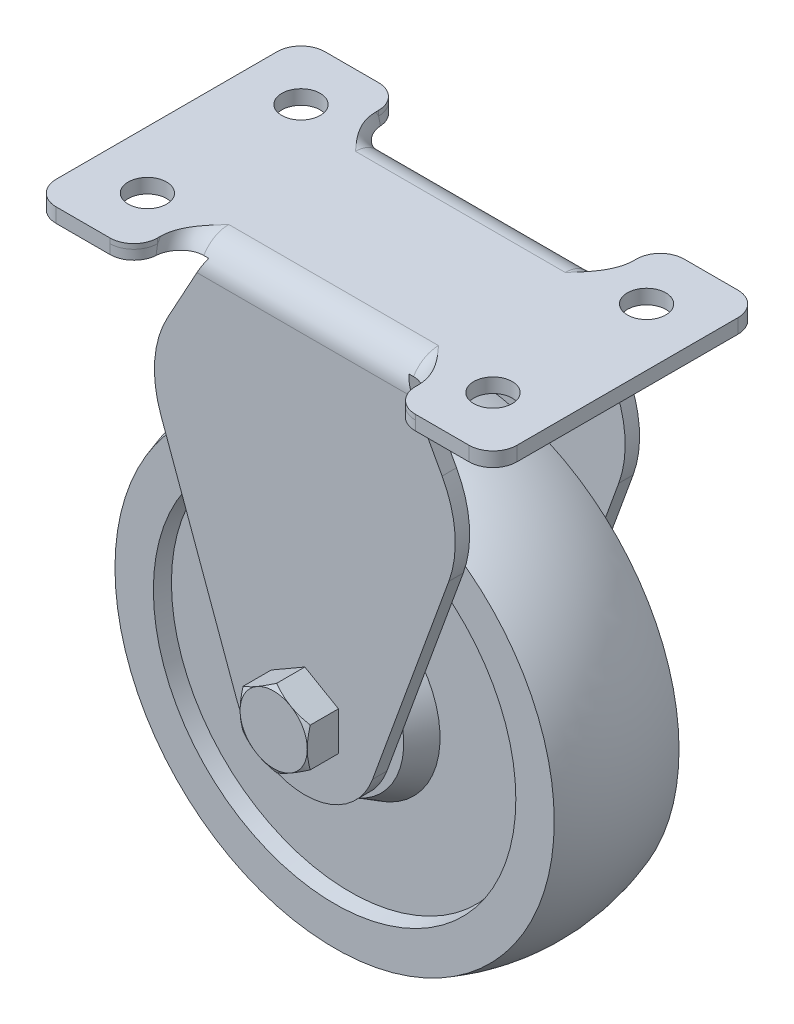
from build123d import *

# Parameters (mm, degrees)
SKETCH4_R           = 3.175
BOSS_EXTRUDE1_DEPTH = 2.38125
SKETCH8_W           = 76.2
SKETCH8_H           = 96.8375
BOSS_EXTRUDE3_DEPTH = 15.24
SHELL1_T            = -2.38125
CUT_EXTRUDE4_START  = -15.24
CUT_EXTRUDE4_DEPTH  = 30.48
SKETCH19_W          = 42.613705398
SKETCH19_H          = 2.38125
CUT_EXTRUDE8_DEPTH  = 111.601707303
BOSS_EXTRUDE5_DEPTH = 5.1562
SKETCH12_OUTSIDE_W  = 497.412
SKETCH12_OUTSIDE_H  = 518.05
SKETCH12_OUTSIDE_R  = 5.55625
CUT_EXTRUDE2_DEPTH  = 113.453004062
CUT_EXTRUDE2_DRAFT  = -60
SKETCH16_R          = 3.96875
BOSS_EXTRUDE6_DEPTH = 35.6362
SKETCH18_W          = 76.2
SKETCH18_H          = 25.7175
CUT_EXTRUDE7_DEPTH  = 105.247512275
FILLET1_START       = -21.306852699
FILLET1_DEPTH       = 42.613705398
FILLET2_R           = 2.38125
FILLET3_R           = 3.9624
FILLET4_R           = 3.9624


with BuildPart() as part:
    # Sketch3 → Revolve1 (revolve)
    with BuildSketch(Plane(origin=(0, 0, 0), x_dir=(0, 0, -1), z_dir=(1, 0, 0)), mode=Mode.PRIVATE) as revolve1_sk:
        with BuildLine():
            Line((-11.58875, -58.7375), (-11.58875, -46.0375))
            Line((-11.58875, -46.0375), (-7.77875, -43.837795474))
            Line((-7.77875, -43.837795474), (-7.77875, -29.213370531))
            Line((-7.77875, -29.213370531), (-10.31875, -28.7655))
            Line((-10.31875, -28.7655), (-10.31875, -22.4155))
            ThreePointArc((-10.31875, -22.4155), (0, -20.6375), (10.31875, -22.4155))
            Line((10.31875, -22.4155), (10.31875, -28.7655))
            Line((10.31875, -28.7655), (7.77875, -29.213370531))
            Line((7.77875, -29.213370531), (7.77875, -43.837795474))
            Line((7.77875, -43.837795474), (11.58875, -46.0375))
            Line((11.58875, -46.0375), (11.58875, -58.7375))
            Line((11.58875, -58.7375), (-11.58875, -58.7375))
        make_face()
    revolve(revolve1_sk.sketch.rotate(Axis((0, -58.7375, 11.58875), (0, 0, 1)), 90), axis=Axis((0, -58.7375, 11.58875), (0, 0, 1)))


with BuildPart() as body_2:
    # Sketch4 → Boss-Extrude1 (new body)
    with BuildSketch(Plane(origin=(0, 0, 0), x_dir=(1, 0, 0), z_dir=(0, 1, 0))):
        with BuildLine():
            Line((-34.1376, 22.225), (34.1376, 22.225))
            ThreePointArc((34.1376, 22.225), (36.93943991, 21.06443991), (38.1, 18.2626))
            Line((38.1, 18.2626), (38.1, -18.2626))
            ThreePointArc((38.1, -18.2626), (36.93943991, -21.06443991), (34.1376, -22.225))
            Line((34.1376, -22.225), (-34.1376, -22.225))
            ThreePointArc((-34.1376, -22.225), (-36.93943991, -21.06443991), (-38.1, -18.2626))
            Line((-38.1, -18.2626), (-38.1, 18.2626))
            ThreePointArc((-38.1, 18.2626), (-36.93943991, 21.06443991), (-34.1376, 22.225))
        make_face()
        with Locations(Location((-28.575, 12.7, 0), (0, 0, 270))):
            Circle(SKETCH4_R, mode=Mode.SUBTRACT)
        with Locations(Location((-28.575, -12.7, 0), (0, 0, 90))):
            Circle(SKETCH4_R, mode=Mode.SUBTRACT)
        with Locations(Location((28.575, -12.7, 0), (0, 0, 270))):
            Circle(SKETCH4_R, mode=Mode.SUBTRACT)
        with Locations(Location((28.575, 12.7, 0), (0, 0, 90))):
            Circle(SKETCH4_R, mode=Mode.SUBTRACT)
    extrude(amount=-BOSS_EXTRUDE1_DEPTH)

    # Sketch19 → Cut-Extrude8 (cut, through all)
    with BuildSketch(Plane.XY.offset(15.24)):
        with Locations((0, -1.190625)):
            Rectangle(SKETCH19_W, SKETCH19_H)
    cut_extrude8 = extrude(amount=CUT_EXTRUDE8_DEPTH, mode=Mode.SUBTRACT)

    # Mirror2: Cut-Extrude8 across plane
    add(cut_extrude8.mirror(Plane.XY), mode=Mode.SUBTRACT)


with BuildPart() as body_3:
    # Sketch8 → Boss-Extrude3 (new, symmetric)
    with BuildSketch(Plane.XY):
        with Locations((0, -48.41875)):
            Rectangle(SKETCH8_W, SKETCH8_H)
    extrude(amount=BOSS_EXTRUDE3_DEPTH, both=True)

    # Shell1
    shell1_openings = [body_3.faces().sort_by_distance(p)[0] for p in [
        (0, -96.8375, 0),
    ]]
    offset(amount=SHELL1_T, openings=shell1_openings, kind=Kind.INTERSECTION)

    # Cut-Extrude4: read off the stored shape, not the designer's step
    # Cut-Extrude4 outline → Cut-Extrude4 (cut)
    with BuildSketch(Plane.XY.offset(CUT_EXTRUDE4_START)):
        with BuildLine():
            Line((-15.24, 0), (-38.1, 0))
            Line((-38.1, 0), (-38.1, -96.8375))
            Line((-38.1, -96.8375), (38.1, -96.8375))
            Line((38.1, -96.8375), (38.1, 0))
            Line((38.1, 0), (15.24, 0))
            Line((15.24, 0), (22.703153261, -13.624868271))
            ThreePointArc((22.703153261, -13.624868271), (24.823839071, -20.768562418), (23.809680661, -28.151052316))
            Line((23.809680661, -28.151052316), (11.194182314, -62.811849159))
            ThreePointArc((11.194182314, -62.811849159), (0, -70.6501), (-11.194182314, -62.811849159))
            Line((-11.194182314, -62.811849159), (-23.809680661, -28.151052316))
            ThreePointArc((-23.809680661, -28.151052316), (-24.823839071, -20.768562418), (-22.703153261, -13.624868271))
            Line((-22.703153261, -13.624868271), (-15.24, 0))
        make_face()
    extrude(amount=CUT_EXTRUDE4_DEPTH, mode=Mode.SUBTRACT)


with BuildPart() as body_4:
    # Sketch11 → Boss-Extrude5 (new body)
    with BuildSketch(Plane.XY.offset(15.24)):
        Polygon((0, -65.153304866), (5.55625, -61.945402433), (5.55625, -55.529597567), (0, -52.321695134), (-5.55625, -55.529597567), (-5.55625, -61.945402433), align=None)
    extrude(amount=BOSS_EXTRUDE5_DEPTH)


with BuildPart() as cut_extrude2_tool:
    # Sketch12 outside → Cut-Extrude2 (with draft: the straight prism first)
    with BuildSketch(Plane.XY.offset(20.3962)):
        with Locations((0, -48.419)):
            Rectangle(SKETCH12_OUTSIDE_W, SKETCH12_OUTSIDE_H)
        with Locations((0, -58.7375)):
            Circle(SKETCH12_OUTSIDE_R, mode=Mode.SUBTRACT)
    extrude(amount=-CUT_EXTRUDE2_DEPTH)
    # Cut-Extrude2: the draft: its side faces are tilted about the plane it starts from
    cut_extrude2_sides = [cut_extrude2_tool.faces().sort_by_distance(p)[0] for p in [
        (0, -307.444, -36.330302031),
        (248.706, -48.419, -36.330302031),
        (0, 210.606, -36.330302031),
        (-248.706, -48.419, -36.330302031),
        (-5.55625, -58.7375, -36.330302031),
    ]]
    draft(cut_extrude2_sides, Plane.XY.offset(20.3962), CUT_EXTRUDE2_DRAFT)


with BuildPart() as body_4_1:
    add(body_4.part)

    # Cut-Extrude2: cut by cut_extrude2_tool
    add(cut_extrude2_tool.part, mode=Mode.SUBTRACT)


with BuildPart() as body_5:
    # Mirror1: mirrored copy
    add(body_4_1.part.mirror(Plane.XY))


with BuildPart() as body_4_2:
    add(body_4_1.part)

    add(body_3.part)  # Boss-Extrude6 merges body 3
    # Sketch16 → Boss-Extrude6 (add)
    with BuildSketch(Plane.XY.offset(-15.24)):
        with Locations(Location((0, -58.7375, 0), (0, 0, 180))):
            Circle(SKETCH16_R)
    extrude(amount=BOSS_EXTRUDE6_DEPTH)

    # Sketch18 → Cut-Extrude7 (cut, through all)
    with BuildSketch(Plane.XZ.offset(2.38125)):
        Rectangle(SKETCH18_W, SKETCH18_H)
    extrude(amount=-CUT_EXTRUDE7_DEPTH, mode=Mode.SUBTRACT)

    # Combine1: union body 5, body 2
    add(body_5.part)
    add(body_2.part)

    # Fillet1: read off the stored shape, not the designer's step
    # Fillet1 outline → Fillet1 (cut)
    with BuildSketch(Plane.YZ.offset(FILLET1_START)):
        with BuildLine():
            Line((0, -15.24), (0, -10.4775))
            ThreePointArc((0, -10.4775), (-1.394903955, -13.845096045), (-4.7625, -15.24))
            Line((-4.7625, -15.24), (0, -15.24))
        make_face()
        with BuildLine():
            Line((0, 10.4775), (0, 15.24))
            Line((0, 15.24), (-4.7625, 15.24))
            ThreePointArc((-4.7625, 15.24), (-1.394903955, 13.845096045), (0, 10.4775))
        make_face()
    extrude(amount=FILLET1_DEPTH, mode=Mode.SUBTRACT)

    # Fillet2
    fillet2_edges = [body_4_2.edges().sort_by_distance(p)[0] for p in [
        (0, -2.38125, -12.85875),
        (0, -2.38125, 12.85875),
    ]]
    fillet(fillet2_edges, radius=FILLET2_R)

    # Fillet3
    # the kernel refuses this fillet: 3.9624 mm, written as the material it adds along each edge
    with BuildSketch(Plane(origin=(-21.306852699, -4.762500001, -10.477499999), x_dir=(0, -0.48780626123969195, 0.8729519182036051), z_dir=(0, -0.8729519182036051, -0.48780626123969195))) as fillet3_piece_1_section:
        with BuildLine():
            CenterArc((4.762500001 + FILLET3_R, -FILLET3_R), FILLET3_R, 90, 90)
            Line((4.762500001, -FILLET3_R), (4.762500001, 0))
            Line((4.762500001, 0), (4.762500001 + FILLET3_R, 0))
        make_face()
    fillet3_piece_1 = revolve(axis=Axis((-21.306852699, -4.762500001, -10.477499999), (-1, 0, 0)), revolution_arc=298.392990396, mode=Mode.PRIVATE)
    fillet3_piece_1 = split(fillet3_piece_1, bisect_by=Plane(origin=(-21.306852699, -2.38125, -10.477499999), z_dir=(0, 1, 0)), keep=Keep.TOP, mode=Mode.PRIVATE)
    fillet3_piece_1 = split(fillet3_piece_1, bisect_by=Plane(origin=(-21.306852699, 0, -10.477499999), z_dir=(0, -1, 0)), keep=Keep.TOP, mode=Mode.PRIVATE)
    add(fillet3_piece_1)
    with BuildSketch(Plane(origin=(21.306852699, -4.762500001, -10.477499999), x_dir=(0, -0.48780626123969195, 0.8729519182036051), z_dir=(0, -0.8729519182036051, -0.48780626123969195))) as fillet3_piece_2_section:
        with BuildLine():
            CenterArc((4.762500001 + FILLET3_R, FILLET3_R), FILLET3_R, 180, 90)
            Line((4.762500001, FILLET3_R), (4.762500001, 0))
            Line((4.762500001, 0), (4.762500001 + FILLET3_R, 0))
        make_face()
    fillet3_piece_2 = revolve(axis=Axis((21.306852699, -4.762500001, -10.477499999), (-1, 0, 0)), revolution_arc=298.392990396, mode=Mode.PRIVATE)
    fillet3_piece_2 = split(fillet3_piece_2, bisect_by=Plane(origin=(21.306852699, -2.38125, -10.477499999), z_dir=(0, 1, 0)), keep=Keep.TOP, mode=Mode.PRIVATE)
    fillet3_piece_2 = split(fillet3_piece_2, bisect_by=Plane(origin=(21.306852699, 0, -10.477499999), z_dir=(0, -1, 0)), keep=Keep.TOP, mode=Mode.PRIVATE)
    add(fillet3_piece_2)
    with BuildSketch(Plane(origin=(-21.306852699, -4.762500001, 10.477499999), x_dir=(0, -0.9999016680682267, 0.014023344621653272), z_dir=(0, -0.014023344621653272, -0.9999016680682267))) as fillet3_piece_3_section:
        with BuildLine():
            CenterArc((4.762500001 + FILLET3_R, -FILLET3_R), FILLET3_R, 90, 90)
            Line((4.762500001, -FILLET3_R), (4.762500001, 0))
            Line((4.762500001, 0), (4.762500001 + FILLET3_R, 0))
        make_face()
    fillet3_piece_3 = revolve(axis=Axis((-21.306852699, -4.762500001, 10.477499999), (-1, 0, 0)), revolution_arc=298.392990396, mode=Mode.PRIVATE)
    fillet3_piece_3 = split(fillet3_piece_3, bisect_by=Plane(origin=(-21.306852699, -2.38125, 10.477499999), z_dir=(0, 1, 0)), keep=Keep.TOP, mode=Mode.PRIVATE)
    fillet3_piece_3 = split(fillet3_piece_3, bisect_by=Plane(origin=(-21.306852699, 0, 10.477499999), z_dir=(0, -1, 0)), keep=Keep.TOP, mode=Mode.PRIVATE)
    add(fillet3_piece_3)
    with BuildSketch(Plane(origin=(21.306852699, -4.762500001, 10.477499999), x_dir=(0, -0.9999016680682267, 0.014023344621652526), z_dir=(0, -0.014023344621652526, -0.9999016680682267))) as fillet3_piece_4_section:
        with BuildLine():
            CenterArc((4.762500001 + FILLET3_R, FILLET3_R), FILLET3_R, 180, 90)
            Line((4.762500001 + FILLET3_R, 0), (4.762500001, 0))
            Line((4.762500001, 0), (4.762500001, FILLET3_R))
        make_face()
    fillet3_piece_4 = revolve(axis=Axis((21.306852699, -4.762500001, 10.477499999), (-1, 0, 0)), revolution_arc=298.392990396, mode=Mode.PRIVATE)
    fillet3_piece_4 = split(fillet3_piece_4, bisect_by=Plane(origin=(21.306852699, -2.38125, 10.477499999), z_dir=(0, 1, 0)), keep=Keep.TOP, mode=Mode.PRIVATE)
    fillet3_piece_4 = split(fillet3_piece_4, bisect_by=Plane(origin=(21.306852699, 0, 10.477499999), z_dir=(0, -1, 0)), keep=Keep.TOP, mode=Mode.PRIVATE)
    add(fillet3_piece_4)

    # Fillet4
    fillet4_edges = [body_4_2.edges().sort_by_distance(p)[0] for p in [
        (21.306852699, -1.190625, -22.225),
        (21.306852699, -1.190625, 22.225),
        (-21.306852699, -1.190625, -22.225),
        (-21.306852699, -1.190625, 22.225),
    ]]
    fillet(fillet4_edges, radius=FILLET4_R)


solid = Compound([part.part, body_4_2.part])
